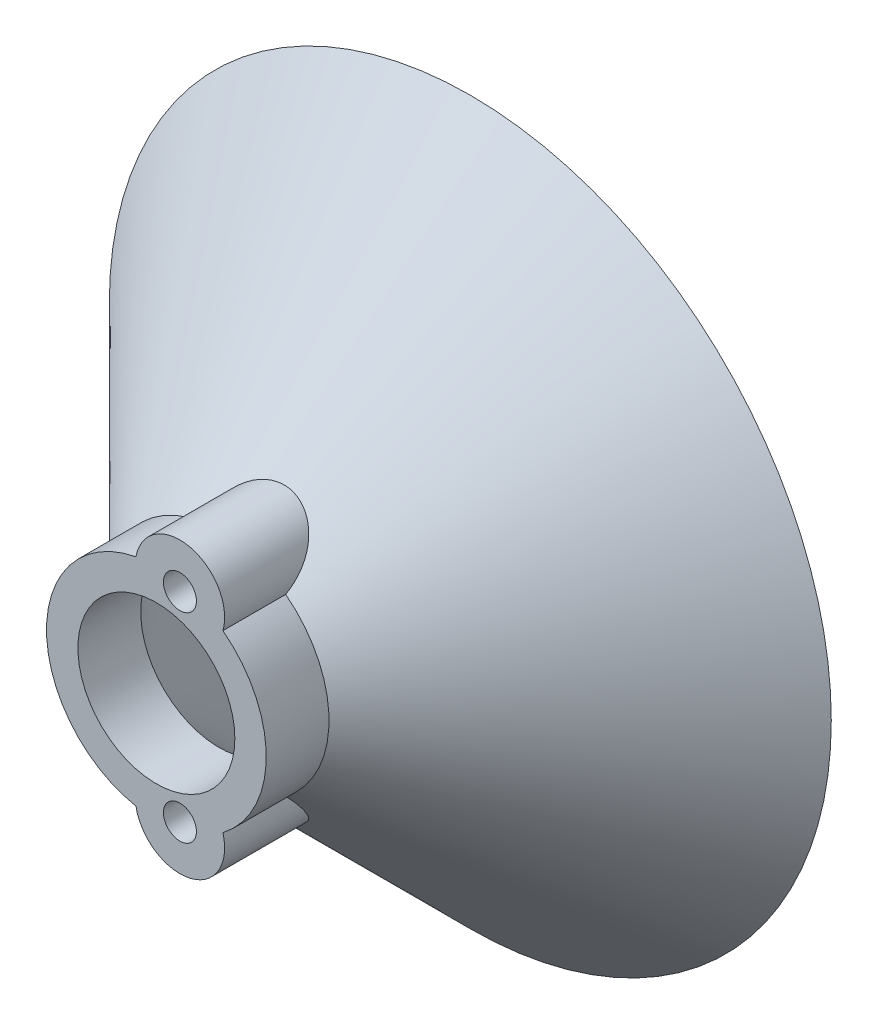
from build123d import *

# Parameters (mm, degrees)
SKETCH_1_R          = 5
SKETCH_1_R_2        = 1.05
EXTRUDE_1_DEPTH     = 4
SKETCH_2_R          = 7
EXTRUDE_2_DEPTH     = 16
EXTRUDE_2_DRAFT     = -45
SKETCH_3_R          = 5
CUT_EXTRUDE_1_DEPTH = 37.249137921
CUT_EXTRUDE_1_DRAFT = 45
EXTRUDE_3_REACH     = 38.249
EXTRUDE_5_REACH     = 38.249
SKETCH_5_R          = 1.05


with BuildPart() as part:
    # Эскиз1 → Бобышка-Вытянуть1 (new body)
    with BuildSketch(Plane.XY):
        with BuildLine():
            ThreePointArc((4.238569781, 5.570864045), (2.154220601, 9.133895349), (-1.302578577, 6.877738658))
            ThreePointArc((-1.302578577, 6.877738658), (-7, 0), (-1.302578577, -6.877738658))
            ThreePointArc((-1.302578577, -6.877738658), (2.154220601, -9.133895349), (4.238569781, -5.570864045))
            ThreePointArc((4.238569781, -5.570864045), (7, 0), (4.238569781, 5.570864045))
        make_face()
        Circle(SKETCH_1_R, mode=Mode.SUBTRACT)
        with Locations((1.5, 6.36)):
            Circle(SKETCH_1_R_2, mode=Mode.SUBTRACT)
        with Locations((1.5, -6.36)):
            Circle(SKETCH_1_R_2, mode=Mode.SUBTRACT)
    extrude(amount=EXTRUDE_1_DEPTH)


with BuildPart() as extrude_2_tool:
    # Эскиз2 → Бобышка-Вытянуть2 (with draft: the straight prism first)
    with BuildSketch(Plane(origin=(0, 0, 0), x_dir=(-1, 0, 0), z_dir=(0, 0, -1))):
        Circle(SKETCH_2_R)
    extrude(amount=EXTRUDE_2_DEPTH)
    # Бобышка-Вытянуть2: the draft: its side faces are tilted about the plane it starts from
    extrude_2_sides = [extrude_2_tool.faces().sort_by_distance(p)[0] for p in [
        (7, 0, -8),
    ]]
    draft(extrude_2_sides, Plane(origin=(0, 0, 0), x_dir=(-1, 0, 0), z_dir=(0, 0, -1)), EXTRUDE_2_DRAFT)


with BuildPart() as part_1:
    add(part.part)

    # Бобышка-Вытянуть2: add extrude_2_tool
    add(extrude_2_tool.part)


with BuildPart() as cut_extrude_1_tool:
    # Эскиз3 → Вырез-Вытянуть1 (with draft: the straight prism first)
    with BuildSketch(Plane.XY):
        Circle(SKETCH_3_R)
    extrude(amount=-CUT_EXTRUDE_1_DEPTH)
    # Вырез-Вытянуть1: the draft: its side faces are tilted about the plane it starts from
    cut_extrude_1_sides = [cut_extrude_1_tool.faces().sort_by_distance(p)[0] for p in [
        (-5, 0, -18.62456896),
    ]]
    draft(cut_extrude_1_sides, Plane.XY, CUT_EXTRUDE_1_DRAFT)


with BuildPart() as part_2:
    add(part_1.part)

    # Вырез-Вытянуть1: cut by cut_extrude_1_tool
    add(cut_extrude_1_tool.part, mode=Mode.SUBTRACT)

    # Эскиз4 → Бобышка-Вытянуть3 (add, up to next)
    with BuildSketch(Plane(origin=(0, 0, 0), x_dir=(-1, 0, 0), z_dir=(0, 0, -1)), mode=Mode.PRIVATE) as extrude_3_sk1:
        with BuildLine():
            ThreePointArc((-4.238569781, -5.570864045), (-3.421196432, -6.106997214), (-2.537107101, -6.524039206))
            ThreePointArc((-2.537107101, -6.524039206), (-1.741028643, -7.381961444), (-0.645490628, -6.970175166))
            ThreePointArc((-0.645490628, -6.970175166), (0.331778948, -6.992132917), (1.302578577, -6.877738658))
            ThreePointArc((1.302578577, -6.877738658), (-2.154220601, -9.133895349), (-4.238569781, -5.570864045))
        make_face()
    extrude_3_tool1 = extrude(extrude_3_sk1.sketch, amount=EXTRUDE_3_REACH, mode=Mode.PRIVATE) - part_2.part
    # Эскиз4 → Бобышка-Вытянуть3 (add, up to next)
    with BuildSketch(Plane(origin=(0, 0, 0), x_dir=(-1, 0, 0), z_dir=(0, 0, -1)), mode=Mode.PRIVATE) as extrude_3_sk2:
        with BuildLine():
            ThreePointArc((1.302578577, 6.877738658), (0.331778948, 6.992132917), (-0.645490628, 6.970175166))
            ThreePointArc((-0.645490628, 6.970175166), (-1.741028643, 7.381961444), (-2.537107101, 6.524039206))
            ThreePointArc((-2.537107101, 6.524039206), (-3.421196432, 6.106997214), (-4.238569781, 5.570864045))
            ThreePointArc((-4.238569781, 5.570864045), (-2.154220601, 9.133895349), (1.302578577, 6.877738658))
        make_face()
    extrude_3_tool2 = extrude(extrude_3_sk2.sketch, amount=EXTRUDE_3_REACH, mode=Mode.PRIVATE) - part_2.part
    add(extrude_3_tool1.solids().sort_by_distance((1.821212, -7.721939, 0))[0])
    add(extrude_3_tool2.solids().sort_by_distance((1.821212, 7.721939, 0))[0])

    # Эскиз5 → Бобышка-Вытянуть5 (add, up to next)
    with BuildSketch(Plane.XY, mode=Mode.PRIVATE) as extrude_5_sk1:
        with Locations((1.5, 6.36)):
            Circle(SKETCH_5_R)
    extrude_5_tool1 = extrude(extrude_5_sk1.sketch, amount=-EXTRUDE_5_REACH, mode=Mode.PRIVATE) - part_2.part
    # Эскиз5 → Бобышка-Вытянуть5 (add, up to next)
    with BuildSketch(Plane.XY, mode=Mode.PRIVATE) as extrude_5_sk2:
        with Locations((1.5, -6.36)):
            Circle(SKETCH_5_R)
    extrude_5_tool2 = extrude(extrude_5_sk2.sketch, amount=-EXTRUDE_5_REACH, mode=Mode.PRIVATE) - part_2.part
    add(extrude_5_tool1.solids().sort_by_distance((1.5, 6.36, 0))[0])
    add(extrude_5_tool2.solids().sort_by_distance((1.5, -6.36, 0))[0])


solid = part_2.part
